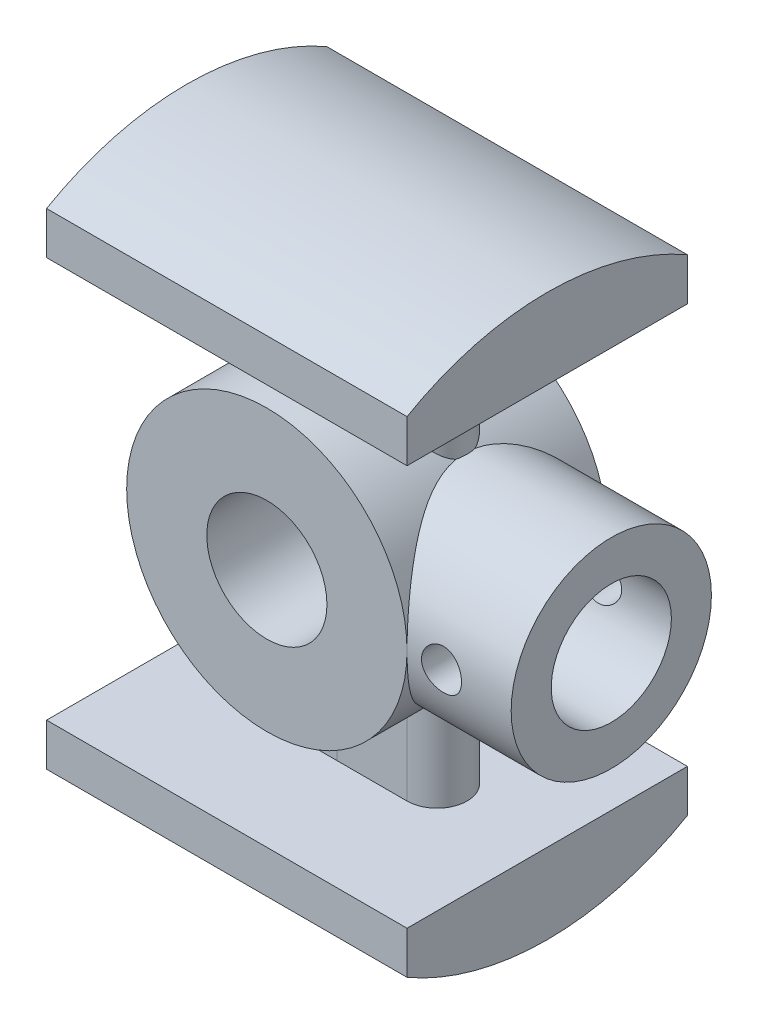
from build123d import *

# Parameters (mm, degrees)
SKETCH2_R             = 11.1125
SKETCH2_R_2           = 4.7625
BOSS_EXTRUDE1_DEPTH   = 15.875
BOSS_EXTRUDE2_DEPTH   = 14.2875
BOSS_EXTRUDE2_2_DEPTH = 14.2875
SKETCH4_R             = 7.9375
SKETCH4_R_2           = 4.7625
BOSS_EXTRUDE3_DEPTH   = 12.7
SKETCH5_R             = 4.7625
CUT_EXTRUDE1_DEPTH    = 12.7
BOSS_EXTRUDE4_DEPTH   = 8.097855923
MIRROR1_START         = 7.777144077
MIRROR1_DEPTH         = 8.097855923
SKETCH7_R             = 1.5875
CUT_EXTRUDE2_DEPTH    = 36.099190662


with BuildPart() as part:
    # Sketch2 → Boss-Extrude1 (new body)
    with BuildSketch(Plane.XY):
        Circle(SKETCH2_R)
        Circle(SKETCH2_R_2, mode=Mode.SUBTRACT)
    extrude(amount=BOSS_EXTRUDE1_DEPTH)

    # Sketch5 → Cut-Extrude1 (cut)
    with BuildSketch(Plane(origin=(19.3675, 0, 0), x_dir=(0, 0, -1), z_dir=(1, 0, 0))):
        with Locations((-7.9375, 0)):
            Circle(SKETCH5_R)
    extrude(amount=-CUT_EXTRUDE1_DEPTH, mode=Mode.SUBTRACT)


with BuildPart() as body_2:
    # Sketch3 → Boss-Extrude2 (new, symmetric)
    with BuildSketch(Plane(origin=(0, 0, 0), x_dir=(0, 0, -1), z_dir=(1, 0, 0))):
        with BuildLine():
            Line((-19.05, 15.875), (3.175, 15.875))
            Line((3.175, 15.875), (3.175, 19.247414599))
            ThreePointArc((3.175, 19.247414599), (-7.9375, 22.225), (-19.05, 19.247414599))
            Line((-19.05, 19.247414599), (-19.05, 15.875))
        make_face()
    extrude(amount=BOSS_EXTRUDE2_DEPTH, both=True)


with BuildPart() as body_3:
    # Sketch3 → Boss-Extrude2 2 (new, symmetric)
    with BuildSketch(Plane(origin=(0, 0, 0), x_dir=(0, 0, -1), z_dir=(1, 0, 0))):
        with BuildLine():
            Line((-19.05, -15.875), (-19.05, -19.247414599))
            ThreePointArc((-19.05, -19.247414599), (-7.9375, -22.225), (3.175, -19.247414599))
            Line((3.175, -19.247414599), (3.175, -15.875))
            Line((3.175, -15.875), (-19.05, -15.875))
        make_face()
    extrude(amount=BOSS_EXTRUDE2_2_DEPTH, both=True)


with BuildPart() as body_4:
    # Sketch4 → Boss-Extrude3 (new body)
    with BuildSketch(Plane(origin=(19.3675, 0, 0), x_dir=(0, 0, -1), z_dir=(1, 0, 0))):
        with Locations((-7.9375, 0)):
            Circle(SKETCH4_R)
        with Locations((-7.9375, 0)):
            Circle(SKETCH4_R_2, mode=Mode.SUBTRACT)
    extrude(amount=-BOSS_EXTRUDE3_DEPTH)


with BuildPart() as boss_extrude4_tool:
    # Boss-Extrude4: read off the stored shape, not the designer's step
    # Boss-Extrude4 outline → Boss-Extrude4 (new body)
    with BuildSketch(Plane(origin=(0, -15.875, 0), x_dir=(1, 0, 0), z_dir=(0, 1, 0))):
        with BuildLine():
            Line((-5.55625, -10.31875), (5.55625, -10.31875))
            ThreePointArc((5.55625, -10.31875), (7.9375, -7.9375), (5.55625, -5.55625))
            Line((5.55625, -5.55625), (-5.55625, -5.55625))
            ThreePointArc((-5.55625, -5.55625), (-7.9375, -7.9375), (-5.55625, -10.31875))
        make_face()
    extrude(amount=BOSS_EXTRUDE4_DEPTH)


with BuildPart() as part_1:
    add(part.part)


with BuildPart() as part_2:
    # Boss-Extrude4: joined with boss_extrude4_tool
    add(part_1.part.fuse(boss_extrude4_tool.part, body_3.part, body_4.part, tol=0.00001))


with BuildPart() as mirror1_tool:
    # Mirror1: read off the stored shape, not the designer's step
    # Mirror1 outline → Mirror1 (new body)
    with BuildSketch(Plane(origin=(0, 0, 0), x_dir=(1, 0, 0), z_dir=(0, 1, 0)).offset(MIRROR1_START)):
        with BuildLine():
            Line((-5.55625, -10.31875), (5.55625, -10.31875))
            ThreePointArc((5.55625, -10.31875), (7.9375, -7.9375), (5.55625, -5.55625))
            Line((5.55625, -5.55625), (-5.55625, -5.55625))
            ThreePointArc((-5.55625, -5.55625), (-7.9375, -7.9375), (-5.55625, -10.31875))
        make_face()
    extrude(amount=MIRROR1_DEPTH)


with BuildPart() as part_3:
    add(part_2.part)


with BuildPart() as part_4:
    # Mirror1: joined with mirror1_tool
    add(part_3.part.fuse(mirror1_tool.part, tol=0.00001))

    # Sketch7 → Cut-Extrude2 (cut, through all)
    with BuildSketch(Plane.XY.offset(15.875)):
        with Locations((13.845440208, 0)):
            Circle(SKETCH7_R)
    extrude(amount=-CUT_EXTRUDE2_DEPTH, mode=Mode.SUBTRACT)


solid = Compound([body_2.part, part_4.part])
